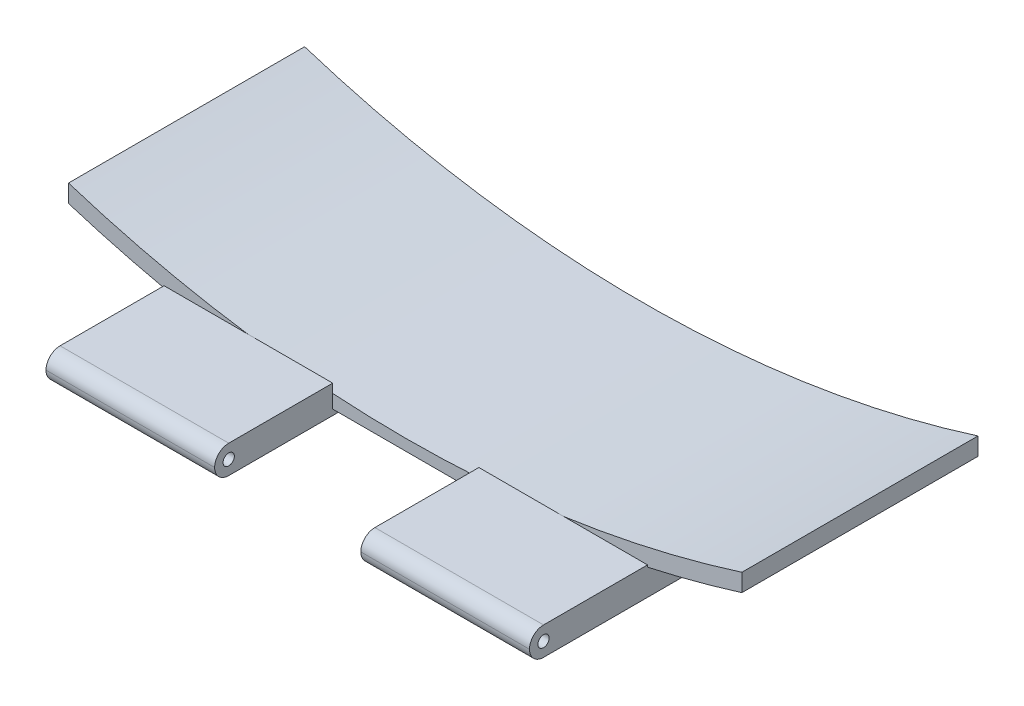
from build123d import *

# Parameters (mm, degrees)
RESSALTO_EXTRUS_O1_DEPTH = 42
SKETCH5_W                = 30
SKETCH5_H                = 5
BOSS_EXTRUDE3_DEPTH      = 21
FILLET1_R                = 2.5
CHAMFER1_SIZE            = 1
ESBO_O2_R                = 1
CORTE_EXTRUS_O1_DEPTH    = 141.585462716


with BuildPart() as part:
    # Esboço1 → Ressalto-extrusão1 (new body)
    with BuildSketch(Plane.XY):
        with BuildLine():
            ThreePointArc((59.825652908, 72.25788881), (-0.070426749, 62.989274947), (-59.955692994, 72.327500038))
            Line((-59.955692994, 72.327500038), (-59.955692994, 69.181335803))
            ThreePointArc((-59.955692994, 69.181335803), (-51.505359903, 66.732393535), (-42.955692994, 64.656666352))
            Line((-42.955692994, 64.656666352), (-42.955692994, 60.00350113))
            Line((-42.955692994, 60.00350113), (43.044307006, 60.00350113))
            Line((43.044307006, 60.00350113), (43.044307006, 64.656666352))
            ThreePointArc((43.044307006, 64.656666352), (51.483258227, 66.702959658), (59.825652908, 69.112869408))
            Line((59.825652908, 69.112869408), (59.825652908, 72.25788881))
        make_face()
    extrude(amount=RESSALTO_EXTRUS_O1_DEPTH)

    # Sketch5 → Boss-Extrude3 (add)
    with BuildSketch(Plane.XY.offset(42)):
        with Locations((-27.955692994, 62.50350113)):
            Rectangle(SKETCH5_W, SKETCH5_H)
        with Locations((28.044307006, 62.50350113)):
            Rectangle(SKETCH5_W, SKETCH5_H)
    extrude(amount=BOSS_EXTRUDE3_DEPTH)

    # Fillet1
    fillet1_edges = [part.edges().sort_by_distance(p)[0] for p in [
        (-27.955692994, 65.00350113, 63),
        (-27.955692994, 60.00350113, 63),
        (28.044307006, 65.00350113, 63),
        (28.044307006, 60.00350113, 63),
    ]]
    fillet(fillet1_edges, radius=FILLET1_R - 0.0001)  # a hair under: the kernel refuses the full size

    # Chamfer1
    chamfer1_edges = [part.edges().sort_by_distance(p)[0] for p in [
        (0.044307006, 60.00350113, 42),
    ]]
    chamfer(chamfer1_edges, length=CHAMFER1_SIZE)

    # Esboço2 → Corte-extrusão1 (cut, through all)
    with BuildSketch(Plane.ZY.offset(42.955692994)):
        with Locations((60.5, 62.50350113)):
            Circle(ESBO_O2_R)
    extrude(amount=-CORTE_EXTRUS_O1_DEPTH, mode=Mode.SUBTRACT)


solid = part.part
